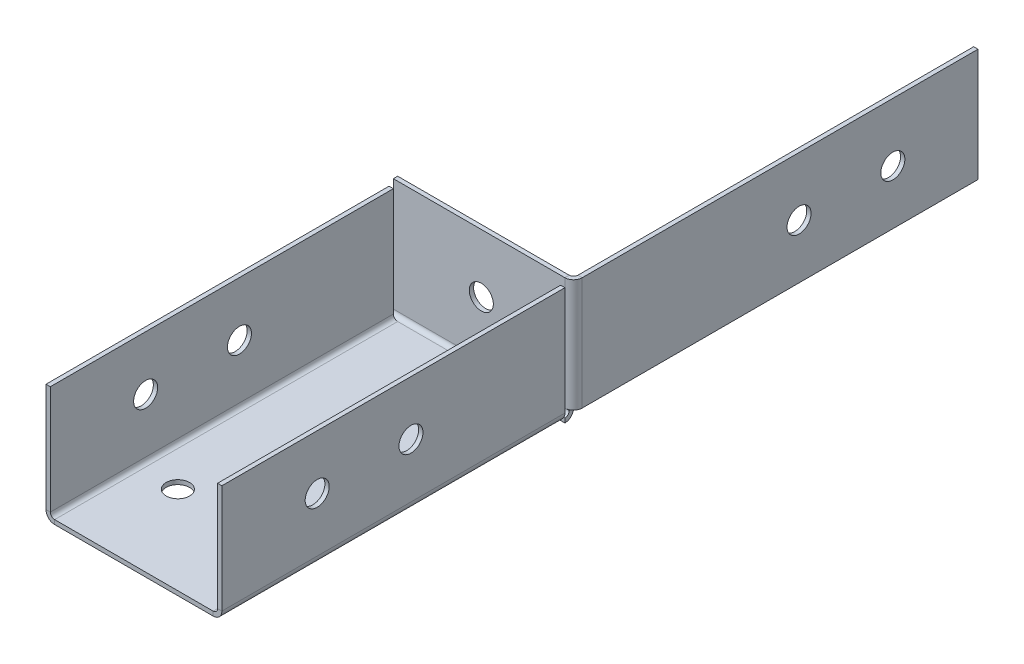
from build123d import *

# Parameters (mm, degrees)
SKETCH1_W                    = 30
SKETCH1_H                    = 60
SKETCH1_R                    = 2
BASE_FLANGE1_DEPTH           = 0.7366
EDGE_FLANGE1_STRIP_W         = 4.4196
EDGE_FLANGE1_STRIP_H         = 0.7366
EDGE_FLANGE1_STRIP_CUT_DEPTH = 30
EDGE_FLANGE1_DEPTH           = 30
EDGE_FLANGE1_PROFILE_W       = 30
EDGE_FLANGE1_PROFILE_H       = 19.2634
EDGE_FLANGE1_PROFILE_R       = 2.05
EDGE_FLANGE1_FLAT_DEPTH      = 0.7366
EDGE_FLANGE2_STRIP_W         = 4.4196
EDGE_FLANGE2_STRIP_H         = 0.7366
EDGE_FLANGE2_STRIP_CUT_DEPTH = 58.5268
EDGE_FLANGE2_DEPTH           = 58.5268
EDGE_FLANGE3_STRIP_W         = 4.4196
EDGE_FLANGE3_STRIP_H         = 0.7366
EDGE_FLANGE3_STRIP_CUT_DEPTH = 58.5268
EDGE_FLANGE3_DEPTH           = 58.5268
EDGE_FLANGE4_STRIP_W         = 4.4196
EDGE_FLANGE4_STRIP_H         = 0.7366
EDGE_FLANGE4_STRIP_CUT_DEPTH = 19.2634
EDGE_FLANGE4_DEPTH           = 19.2634
SKETCH18_R                   = 2.05
CUT_EXTRUDE1_DEPTH           = 409.590672417


# Sheet-metal steps are written as plain solids
with BuildPart() as part:
    # Sketch1 → Base-Flange1 (new body)
    with BuildSketch(Plane(origin=(0, 0, 0), x_dir=(1, 0, 0), z_dir=(0, 1, 0))):
        Rectangle(SKETCH1_W, SKETCH1_H)
        with Locations(Location((7.5, -15, 0), (0, 0, 270))):
            Circle(SKETCH1_R, mode=Mode.SUBTRACT)
        with Locations(Location((0, 15, 0), (0, 0, 270))):
            Circle(SKETCH1_R, mode=Mode.SUBTRACT)
        with Locations(Location((-7.5, -15, 0), (0, 0, 270))):
            Circle(SKETCH1_R, mode=Mode.SUBTRACT)
    extrude(amount=-BASE_FLANGE1_DEPTH)

    # Edge-Flange1 strip (across the edge) → Edge-Flange1 strip cut (cut)
    with BuildSketch(Plane(origin=(15, 0, -30), x_dir=(0, 0, 1), z_dir=(-1, 0, 0))):
        with Locations((-0.7366, -0.3683)):
            Rectangle(EDGE_FLANGE1_STRIP_W, EDGE_FLANGE1_STRIP_H)
    extrude(amount=EDGE_FLANGE1_STRIP_CUT_DEPTH, mode=Mode.SUBTRACT)

    # Edge-Flange1 bend section (across the edge) → Edge-Flange1 (add)
    with BuildSketch(Plane(origin=(15, 0, -30), x_dir=(0, 0, 1), z_dir=(-1, 0, 0))):
        with BuildLine():
            Line((0, 0.7366), (0.7366, 0.7366))
            ThreePointArc((0.7366, 0.7366), (0.952345145, 0.215745145), (1.4732, 0))
            Line((1.4732, 0), (1.4732, -0.7366))
            ThreePointArc((1.4732, -0.7366), (0.43149029, -0.30510971), (0, 0.7366))
        make_face()
    extrude(amount=EDGE_FLANGE1_DEPTH)

    # Edge-Flange1 profile (on flange) → Edge-Flange1 flat (add)
    with BuildSketch(Plane(origin=(0, 0, -30), x_dir=(-1, 0, 0), z_dir=(0, 0, -1))):
        with Locations((0, 10.3683)):
            Rectangle(EDGE_FLANGE1_PROFILE_W, EDGE_FLANGE1_PROFILE_H)
        with Locations((0, 10)):
            Circle(EDGE_FLANGE1_PROFILE_R, mode=Mode.SUBTRACT)
    extrude(amount=-EDGE_FLANGE1_FLAT_DEPTH)

    # Edge-Flange2 strip (across the edge) → Edge-Flange2 strip cut (cut)
    with BuildSketch(Plane(origin=(15, 0, 30), x_dir=(-1, 0, 0), z_dir=(0, 0, -1))):
        with Locations((-0.7366, -0.3683)):
            Rectangle(EDGE_FLANGE2_STRIP_W, EDGE_FLANGE2_STRIP_H)
    extrude(amount=EDGE_FLANGE2_STRIP_CUT_DEPTH, mode=Mode.SUBTRACT)

    # Edge-Flange2 section (across the edge) → Edge-Flange2 (add)
    with BuildSketch(Plane(origin=(15, 0, 30), x_dir=(-1, 0, 0), z_dir=(0, 0, -1))):
        with BuildLine():
            Line((0, 0.7366), (0, 19.2634))
            Line((0, 19.2634), (0.7366, 19.2634))
            Line((0.7366, 19.2634), (0.7366, 0.7366))
            ThreePointArc((0.7366, 0.7366), (0.952345145, 0.215745145), (1.4732, 0))
            Line((1.4732, 0), (1.4732, -0.7366))
            ThreePointArc((1.4732, -0.7366), (0.43149029, -0.30510971), (0, 0.7366))
        make_face()
    extrude(amount=EDGE_FLANGE2_DEPTH)

    # Edge-Flange3 strip (across the edge) → Edge-Flange3 strip cut (cut)
    with BuildSketch(Plane(origin=(-15, 0, -28.5268), x_dir=(1, 0, 0), z_dir=(0, 0, 1))):
        with Locations((-0.7366, -0.3683)):
            Rectangle(EDGE_FLANGE3_STRIP_W, EDGE_FLANGE3_STRIP_H)
    extrude(amount=EDGE_FLANGE3_STRIP_CUT_DEPTH, mode=Mode.SUBTRACT)

    # Edge-Flange3 section (across the edge) → Edge-Flange3 (add)
    with BuildSketch(Plane(origin=(-15, 0, -28.5268), x_dir=(1, 0, 0), z_dir=(0, 0, 1))):
        with BuildLine():
            Line((0, 0.7366), (0, 19.2634))
            Line((0, 19.2634), (0.7366, 19.2634))
            Line((0.7366, 19.2634), (0.7366, 0.7366))
            ThreePointArc((0.7366, 0.7366), (0.952345145, 0.215745145), (1.4732, 0))
            Line((1.4732, 0), (1.4732, -0.7366))
            ThreePointArc((1.4732, -0.7366), (0.43149029, -0.30510971), (0, 0.7366))
        make_face()
    extrude(amount=EDGE_FLANGE3_DEPTH)

    # Edge-Flange4 strip (across the edge) → Edge-Flange4 strip cut (cut)
    with BuildSketch(Plane(origin=(15, 20, -30), x_dir=(-1, 0, 0), z_dir=(0, -1, 0))):
        with Locations((-1.4732, -0.3683)):
            Rectangle(EDGE_FLANGE4_STRIP_W, EDGE_FLANGE4_STRIP_H)
    extrude(amount=EDGE_FLANGE4_STRIP_CUT_DEPTH, mode=Mode.SUBTRACT)

    # Edge-Flange4 section (across the edge) → Edge-Flange4 (add)
    with BuildSketch(Plane(origin=(15, 20, -30), x_dir=(-1, 0, 0), z_dir=(0, -1, 0))):
        with BuildLine():
            Line((-0.7366, 0.7366), (-0.7366, 68.2634))
            Line((-0.7366, 68.2634), (0, 68.2634))
            Line((0, 68.2634), (0, 0.7366))
            ThreePointArc((0, 0.7366), (0.215745145, 0.215745145), (0.7366, 0))
            Line((0.7366, 0), (0.7366, -0.7366))
            ThreePointArc((0.7366, -0.7366), (-0.30510971, -0.30510971), (-0.7366, 0.7366))
        make_face()
    extrude(amount=EDGE_FLANGE4_DEPTH)

    # Sketch18 → Cut-Extrude1 (cut, through all)
    with BuildSketch(Plane(origin=(-385, -11.740421973, -25.126127563), x_dir=(0, 0, 1), z_dir=(-1, 0, 0))):
        with Locations((-42.610472437, 21.740421973)):
            Circle(SKETCH18_R)
        with Locations((-58.610472437, 21.740421973)):
            Circle(SKETCH18_R)
        with Locations(Location((22.862727563, 21.740421973, 0), (0, 0, 90))):
            Circle(SKETCH18_R)
        with Locations(Location((38.862727563, 21.740421973, 0), (0, 0, 90))):
            Circle(SKETCH18_R)
    extrude(amount=-CUT_EXTRUDE1_DEPTH, mode=Mode.SUBTRACT)


solid = part.part
